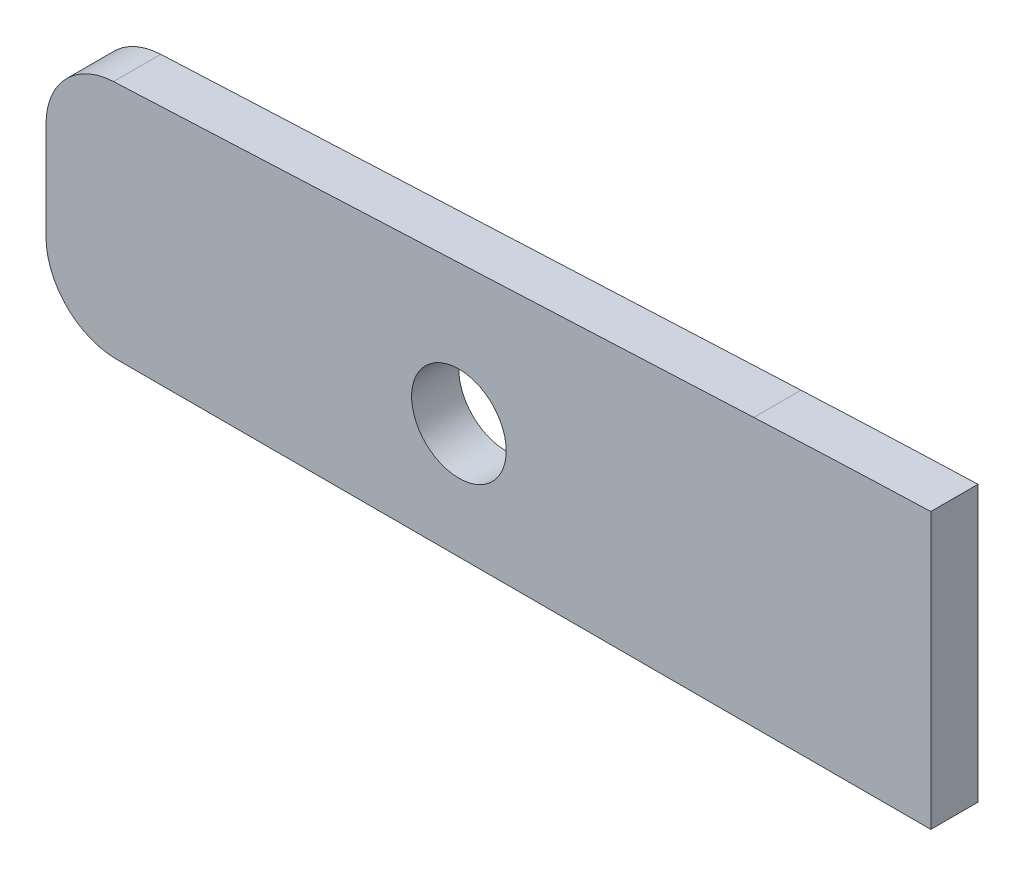
from build123d import *

# Parameters (mm, degrees)
SKETCH_1_R      = 4.01
EXTRUDE_1_DEPTH = 2


with BuildPart() as part:
    # 草图1 → 凸台-拉伸1 (new, symmetric)
    with BuildSketch(Plane.XY):
        with BuildLine():
            Line((-80, -12), (-80, 11.335466495))
            ThreePointArc((-80, 11.335466495), (-87.500922761, 11.06276136), (-95, 10.743307267))
            Line((-95, 10.743307267), (-149.274044434, 8.261800925))
            ThreePointArc((-149.274044434, 8.261800925), (-153.33844826, 6.41268156), (-155, 2.268062555))
            Line((-155, 2.268062555), (-155, -6))
            ThreePointArc((-155, -6), (-153.242640687, -10.242640687), (-149, -12))
            Line((-149, -12), (-80, -12))
        make_face()
        with Locations((-120, -2.211052686)):
            Circle(SKETCH_1_R, mode=Mode.SUBTRACT)
    extrude(amount=EXTRUDE_1_DEPTH, both=True)


solid = part.part
